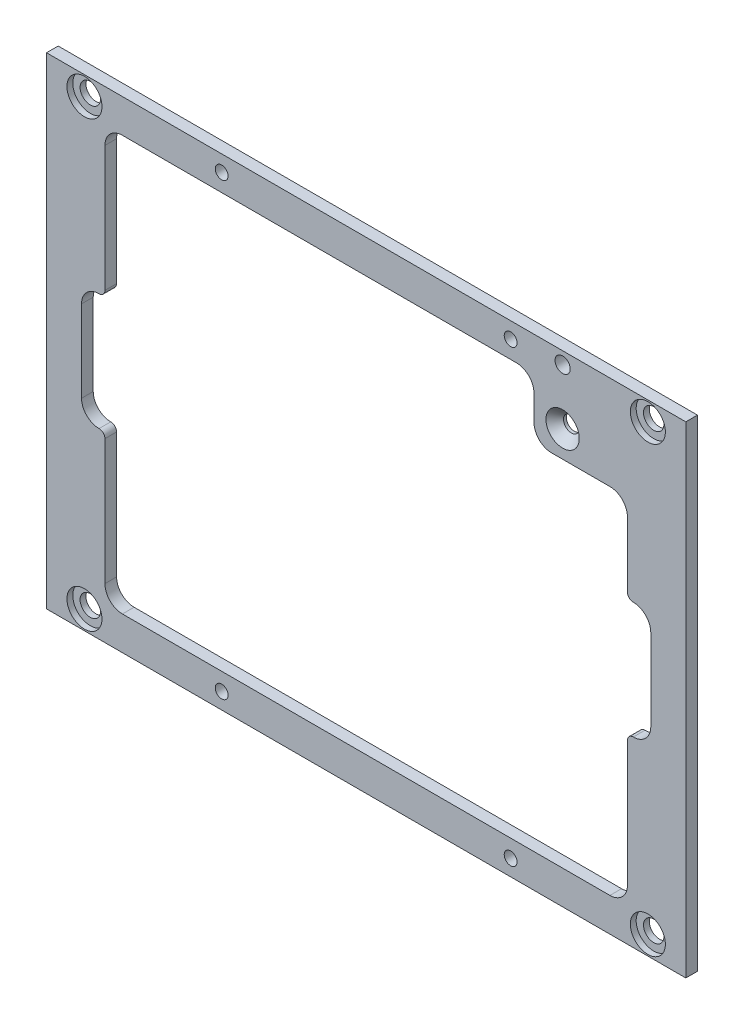
from build123d import *

# Parameters (mm, degrees)
SKETCH1_W                  = 109.5
SKETCH1_H                  = 82.5
BOSS_EXTRUDE1_DEPTH        = 2
F_3_5_3_5_DIAMETER_HOLE1_D = 3.5
F_2_6_2_6_DIAMETER_HOLE1_D = 2.6
SKETCH9_R                  = 3
CUT_EXTRUDE1_DEPTH         = 1
F_2_2_2_2_DIAMETER_HOLE1_D = 2.2
FILLET1_R                  = 1
FILLET2_R                  = 3


with BuildPart() as part:
    # Sketch1 → Boss-Extrude1 (new body)
    with BuildSketch(Plane.XY):
        with Locations((0, -41.75)):
            Rectangle(SKETCH1_W, SKETCH1_H)
        with BuildLine():
            Line((28.75, -9.25), (28.75, -13.6))
            ThreePointArc((28.75, -13.6), (29.628679656, -15.721320344), (31.75, -16.6))
            Line((31.75, -16.6), (41.75, -16.6))
            ThreePointArc((41.75, -16.6), (43.871320344, -17.478679656), (44.75, -19.6))
            Line((44.75, -19.6), (44.75, -31.75))
            Line((44.75, -31.75), (48.75, -31.75))
            Line((48.75, -31.75), (48.75, -41.75))
            Line((48.75, -41.75), (48.75, -51.75))
            Line((48.75, -51.75), (44.75, -51.75))
            Line((44.75, -51.75), (44.75, -74.25))
            ThreePointArc((44.75, -74.25), (43.871320344, -76.371320344), (41.75, -77.25))
            Line((41.75, -77.25), (-41.75, -77.25))
            ThreePointArc((-41.75, -77.25), (-43.871320344, -76.371320344), (-44.75, -74.25))
            Line((-44.75, -74.25), (-44.75, -51.75))
            Line((-44.75, -51.75), (-48.75, -51.75))
            Line((-48.75, -51.75), (-48.75, -31.75))
            Line((-48.75, -31.75), (-44.75, -31.75))
            Line((-44.75, -31.75), (-44.75, -9.25))
            ThreePointArc((-44.75, -9.25), (-43.871320344, -7.128679656), (-41.75, -6.25))
            Line((-41.75, -6.25), (25.75, -6.25))
            ThreePointArc((25.75, -6.25), (27.871320344, -7.128679656), (28.75, -9.25))
        make_face(mode=Mode.SUBTRACT)
    extrude(amount=BOSS_EXTRUDE1_DEPTH)

    # Ø3.5 (3.5) Diameter Hole1 (through all)
    with Locations(Plane.XY.offset(2)):
        with Locations((-48.25, -3.75), (-48.25, -79.75), (48.25, -79.75), (48.25, -3.75)):
            Hole(F_3_5_3_5_DIAMETER_HOLE1_D / 2)

    # Sketch5 → CSK for M2.5 Flat Countersunk Head Screw1 (revolve, cut)
    with BuildSketch(Plane(origin=(33.65, -12.1, 2), x_dir=(0, -1, 0), z_dir=(1, 0, 0))):
        Polygon((0, 0), (0, 2), (1.35, 2), (1.35, 1.5), (2.85, 0), align=None)
    revolve(axis=Axis((33.65, -12.1, 8.35), (0, 0, -1)), mode=Mode.SUBTRACT)

    # Ø2.6 (2.6) Diameter Hole1 (through all)
    with Locations(Plane.XY.offset(2)):
        with Locations((33.65, -2.57)):
            Hole(F_2_6_2_6_DIAMETER_HOLE1_D / 2)

    # Sketch9 → Cut-Extrude1 (cut)
    with BuildSketch(Plane.XY.offset(2)):
        with Locations((-48.25, -3.75)):
            Circle(SKETCH9_R)
        with Locations((48.25, -3.75)):
            Circle(SKETCH9_R)
        with Locations((48.25, -79.75)):
            Circle(SKETCH9_R)
        with Locations((-48.25, -79.75)):
            Circle(SKETCH9_R)
    extrude(amount=-CUT_EXTRUDE1_DEPTH, mode=Mode.SUBTRACT)

    # Ø2.2 (2.2) Diameter Hole1 (through all)
    with Locations(Plane.XY.offset(2)):
        with Locations((-24.75, -3.25), (24.75, -3.25), (-24.75, -80.25), (24.75, -80.25)):
            Hole(F_2_2_2_2_DIAMETER_HOLE1_D / 2)

    # Fillet1
    fillet1_edges = [part.edges().sort_by_distance(p)[0] for p in [
        (-44.75, -31.75, 1),
        (-44.75, -51.75, 1),
        (44.75, -51.75, 1),
        (44.75, -31.75, 1),
    ]]
    fillet(fillet1_edges, radius=FILLET1_R)

    # Fillet2
    fillet2_edges = [part.edges().sort_by_distance(p)[0] for p in [
        (48.75, -31.75, 1),
        (48.75, -51.75, 1),
        (-48.75, -51.75, 1),
        (-48.75, -31.75, 1),
    ]]
    fillet(fillet2_edges, radius=FILLET2_R - 0.0001)  # a hair under: the kernel refuses the full size


solid = part.part
